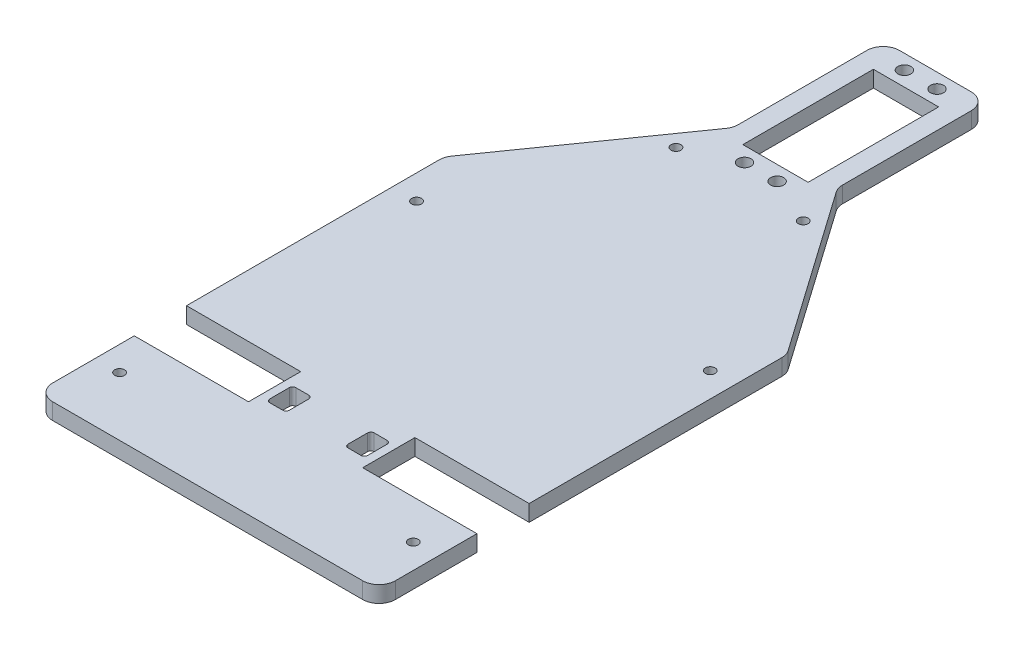
from build123d import *

# Parameters (mm, degrees)
BOSS_EXTRUDE1_DEPTH = 5
SKETCH2_R           = 2
SKETCH2_R_2         = 1.5
SKETCH2_W           = 20
SKETCH2_H           = 40
SKETCH2_W_2         = 35
SKETCH2_H_2         = 16
SKETCH2_W_3         = 6
SKETCH2_H_3         = 8
CUT_EXTRUDE1_DEPTH  = 7
FILLET1_R           = 5
FILLET2_R           = 5
FILLET3_R           = 5
FILLET4_R           = 5
FILLET5_R           = 5
FILLET6_R           = 5
FILLET8_R           = 1
FILLET9_R           = 1
FILLET10_R          = 5


with BuildPart() as part:
    # Sketch1 → Boss-Extrude1 (new body)
    with BuildSketch(Plane(origin=(0, 0, 0), x_dir=(1, 0, 0), z_dir=(0, 1, 0))):
        Polygon((-16, 108), (16, 108), (16, 62), (52.5, 10), (52.5, -115), (-52.5, -115), (-52.5, 10), (-16, 62), align=None)
    extrude(amount=BOSS_EXTRUDE1_DEPTH)

    # Sketch2 → Cut-Extrude1 (cut)
    with BuildSketch(Plane(origin=(0, 5, 0), x_dir=(1, 0, 0), z_dir=(0, 1, 0))):
        with Locations((-5, 103.5)):
            Circle(SKETCH2_R)
        with Locations((5, 103.5)):
            Circle(SKETCH2_R)
        with Locations((-5, 54.5)):
            Circle(SKETCH2_R)
        with Locations((5, 54.5)):
            Circle(SKETCH2_R)
        with Locations((-19.5, 48)):
            Circle(SKETCH2_R_2)
        with Locations((19.5, 48)):
            Circle(SKETCH2_R_2)
        with Locations((45, -6)):
            Circle(SKETCH2_R_2)
        with Locations((-45, -6)):
            Circle(SKETCH2_R_2)
        with Locations((45, -97)):
            Circle(SKETCH2_R_2)
        with Locations((-45, -97)):
            Circle(SKETCH2_R_2)
        with Locations((0, 79)):
            Rectangle(SKETCH2_W, SKETCH2_H)
        with Locations((-35, -77)):
            Rectangle(SKETCH2_W_2, SKETCH2_H_2)
        with Locations((35, -77)):
            Rectangle(SKETCH2_W_2, SKETCH2_H_2)
        with Locations((-12, -78)):
            Rectangle(SKETCH2_W_3, SKETCH2_H_3)
        with Locations((12, -78)):
            Rectangle(SKETCH2_W_3, SKETCH2_H_3)
    extrude(amount=-CUT_EXTRUDE1_DEPTH, mode=Mode.SUBTRACT)

    # Fillet1
    fillet1_edges = [part.edges().sort_by_distance(p)[0] for p in [
        (16, 2.5, -108),
    ]]
    fillet(fillet1_edges, radius=FILLET1_R)

    # Fillet2
    fillet2_edges = [part.edges().sort_by_distance(p)[0] for p in [
        (-16, 2.5, -108),
    ]]
    fillet(fillet2_edges, radius=FILLET2_R)

    # Fillet3
    fillet3_edges = [part.edges().sort_by_distance(p)[0] for p in [
        (52.5, 2.5, -10),
    ]]
    fillet(fillet3_edges, radius=FILLET3_R)

    # Fillet4
    fillet4_edges = [part.edges().sort_by_distance(p)[0] for p in [
        (-52.5, 2.5, -10),
    ]]
    fillet(fillet4_edges, radius=FILLET4_R)

    # Fillet5
    fillet5_edges = [part.edges().sort_by_distance(p)[0] for p in [
        (52.5, 2.5, 115),
    ]]
    fillet(fillet5_edges, radius=FILLET5_R)

    # Fillet6
    fillet6_edges = [part.edges().sort_by_distance(p)[0] for p in [
        (-52.5, 2.5, 115),
    ]]
    fillet(fillet6_edges, radius=FILLET6_R)

    # Fillet8
    fillet8_edges = [part.edges().sort_by_distance(p)[0] for p in [
        (15, 2.5, 74),
    ]]
    fillet(fillet8_edges, radius=FILLET8_R)

    # Fillet9
    fillet9_edges = [part.edges().sort_by_distance(p)[0] for p in [
        (-15, 2.5, 82),
        (-15, 2.5, 74),
        (-9, 2.5, 82),
        (-9, 2.5, 74),
        (9, 2.5, 82),
        (15, 2.5, 82),
        (9, 2.5, 74),
    ]]
    fillet(fillet9_edges, radius=FILLET9_R)

    # Fillet10
    fillet10_edges = [part.edges().sort_by_distance(p)[0] for p in [
        (-16, 2.5, -62),
        (16, 2.5, -62),
    ]]
    fillet(fillet10_edges, radius=FILLET10_R)


solid = part.part
